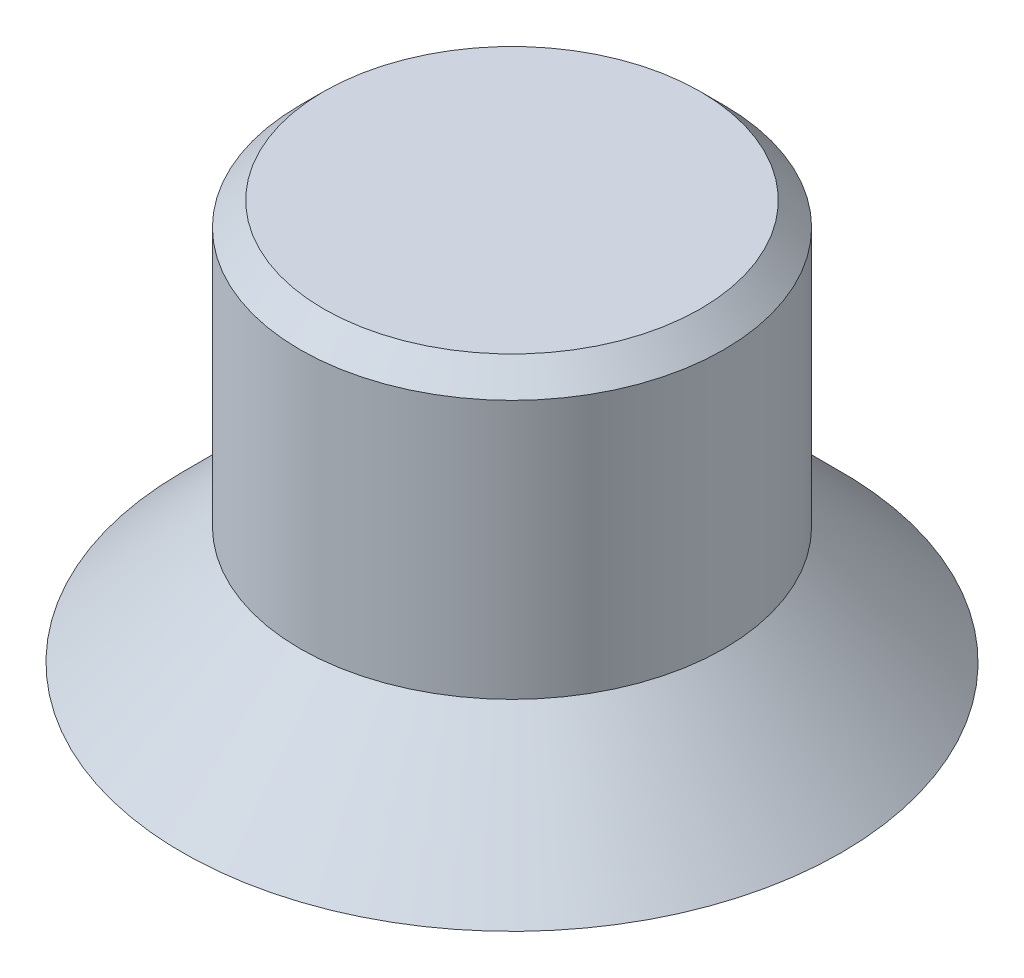
from build123d import *

# Parameters (mm, degrees)
CHAMFER1_SIZE = 0.25


with BuildPart() as part:
    # Sketch1 → Revolve1 (revolve)
    with BuildSketch(Plane.XY):
        Polygon((0, 1), (1.5, 1), (1.676326981, 0), (3.5, 0), (2.25, 1.25), (2.25, 4.25), (0, 4.25), align=None)
    revolve(axis=Axis((0, -277.798061763, 0), (0, 1, 0)))

    # Chamfer1
    chamfer1_edges = [part.edges().sort_by_distance(p)[0] for p in [
        (-2.25, 4.25, 0),
    ]]
    chamfer(chamfer1_edges, length=CHAMFER1_SIZE)


solid = part.part
